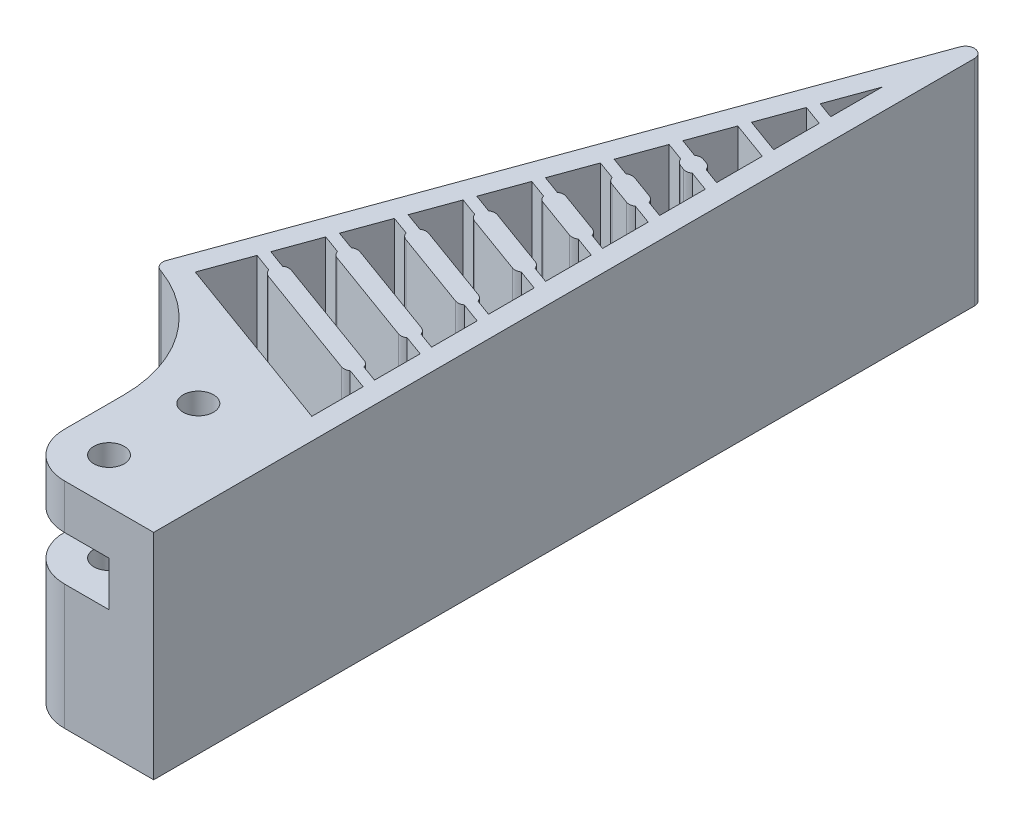
from build123d import *

# Parameters (mm, degrees)
SKETCH_1_R          = 1.7
EXTRUDE_1_DEPTH     = 24
CUT_EXTRUDE_START   = -14
SKETCH_2_R          = 1.7
CUT_EXTRUDE_1_DEPTH = 5
FILLET_1_R          = 1
FILLET_2_R          = 15


with BuildPart() as part:
    # 草图1 → 凸台-拉伸1 (new body)
    with BuildSketch(Plane(origin=(0, 0, 0), x_dir=(1, 0, 0), z_dir=(0, 1, 0))):
        with BuildLine():
            Line((-5, 17.140740034), (-5, 0))
            ThreePointArc((-5, 0), (-3.535533906, -3.535533906), (0, -5))
            Line((0, -5), (10, -5))
            Line((10, -5), (10, 92.570484452))
            Line((10, 92.570484452), (-15.997319233, 21.143436891))
            Line((-15.997319233, 21.143436891), (-5, 17.140740034))
        make_face()
        with Locations(Location((0, 0, 0), (0, 0, 270))):
            Circle(SKETCH_1_R, mode=Mode.SUBTRACT)
        with Locations(Location((0, 10, 0), (0, 0, 270))):
            Circle(SKETCH_1_R, mode=Mode.SUBTRACT)
        with BuildLine():
            Line((7.6, 15.108741736), (-12.9212086, 22.577850837))
            Line((-12.9212086, 22.577850837), (-11.074299826, 27.65219099))
            Line((-11.074299826, 27.65219099), (-9.00697606, 26.899746674))
            ThreePointArc((-9.00697606, 26.899746674), (-8.776165309, 26.502415559), (-8.392030021, 26.250253511))
            Line((-8.392030021, 26.250253511), (4.438901994, 21.58017618))
            ThreePointArc((4.438901994, 21.58017618), (4.895253337, 21.526426111), (5.327464148, 21.682437114))
            Line((5.327464148, 21.682437114), (7.6, 20.855301707))
            Line((7.6, 20.855301707), (7.6, 15.108741736))
        make_face(mode=Mode.SUBTRACT)
        with BuildLine():
            ThreePointArc((5.73788832, 22.810068259), (5.507077569, 23.207399374), (5.122942281, 23.459561422))
            Line((5.122942281, 23.459561422), (-7.707989734, 28.129638753))
            ThreePointArc((-7.707989734, 28.129638753), (-8.164341077, 28.183388821), (-8.596551888, 28.027377819))
            Line((-8.596551888, 28.027377819), (-10.663875654, 28.779822134))
            Line((-10.663875654, 28.779822134), (-9.022178966, 33.290346714))
            Line((-9.022178966, 33.290346714), (-6.9548552, 32.537902399))
            ThreePointArc((-6.9548552, 32.537902399), (-6.724044449, 32.140571284), (-6.339909161, 31.888409236))
            Line((-6.339909161, 31.888409236), (4.438901994, 27.965242815))
            ThreePointArc((4.438901994, 27.965242815), (4.895253337, 27.911492746), (5.327464148, 28.067503748))
            Line((5.327464148, 28.067503748), (7.6, 27.240368342))
            Line((7.6, 27.240368342), (7.6, 22.132315034))
            Line((7.6, 22.132315034), (5.73788832, 22.810068259))
        make_face(mode=Mode.SUBTRACT)
        with BuildLine():
            ThreePointArc((5.73788832, 29.195134893), (5.507077569, 29.592466009), (5.122942281, 29.844628056))
            Line((5.122942281, 29.844628056), (-5.655868874, 33.767794478))
            ThreePointArc((-5.655868874, 33.767794478), (-6.112220217, 33.821544546), (-6.544431028, 33.665533544))
            Line((-6.544431028, 33.665533544), (-8.611754794, 34.417977859))
            Line((-8.611754794, 34.417977859), (-6.970058106, 38.928502439))
            Line((-6.970058106, 38.928502439), (-4.90273434, 38.176058124))
            ThreePointArc((-4.90273434, 38.176058124), (-4.671923589, 37.778727008), (-4.287788301, 37.526564961))
            Line((-4.287788301, 37.526564961), (4.438901994, 34.35030945))
            ThreePointArc((4.438901994, 34.35030945), (4.895253337, 34.296559381), (5.327464148, 34.452570383))
            Line((5.327464148, 34.452570383), (7.6, 33.625434977))
            Line((7.6, 33.625434977), (7.6, 28.517381669))
            Line((7.6, 28.517381669), (5.73788832, 29.195134893))
        make_face(mode=Mode.SUBTRACT)
        with BuildLine():
            ThreePointArc((5.73788832, 35.580201528), (5.507077569, 35.977532644), (5.122942281, 36.229694691))
            Line((5.122942281, 36.229694691), (-3.603748014, 39.405950202))
            ThreePointArc((-3.603748014, 39.405950202), (-4.060099357, 39.459700271), (-4.492310168, 39.303689269))
            Line((-4.492310168, 39.303689269), (-6.559633934, 40.056133584))
            Line((-6.559633934, 40.056133584), (-4.917937246, 44.566658164))
            Line((-4.917937246, 44.566658164), (-2.85061348, 43.814213848))
            ThreePointArc((-2.85061348, 43.814213848), (-2.619802729, 43.416882733), (-2.235667441, 43.164720685))
            Line((-2.235667441, 43.164720685), (4.438901994, 40.735376085))
            ThreePointArc((4.438901994, 40.735376085), (4.895253337, 40.681626016), (5.327464148, 40.837637018))
            Line((5.327464148, 40.837637018), (7.6, 40.010501612))
            Line((7.6, 40.010501612), (7.6, 34.902448304))
            Line((7.6, 34.902448304), (5.73788832, 35.580201528))
        make_face(mode=Mode.SUBTRACT)
        with BuildLine():
            ThreePointArc((5.73788832, 41.965268163), (5.507077569, 42.362599278), (5.122942281, 42.614761326))
            Line((5.122942281, 42.614761326), (-1.551627154, 45.044105927))
            ThreePointArc((-1.551627154, 45.044105927), (-2.007978497, 45.097855995), (-2.440189308, 44.941844993))
            Line((-2.440189308, 44.941844993), (-4.507513074, 45.694289309))
            Line((-4.507513074, 45.694289309), (-2.865816386, 50.204813888))
            Line((-2.865816386, 50.204813888), (-0.79849262, 49.452369573))
            ThreePointArc((-0.79849262, 49.452369573), (-0.567681869, 49.055038458), (-0.183546581, 48.80287641))
            Line((-0.183546581, 48.80287641), (4.438901994, 47.120442719))
            ThreePointArc((4.438901994, 47.120442719), (4.895253337, 47.066692651), (5.327464148, 47.222703653))
            Line((5.327464148, 47.222703653), (7.6, 46.395568247))
            Line((7.6, 46.395568247), (7.6, 41.287514939))
            Line((7.6, 41.287514939), (5.73788832, 41.965268163))
        make_face(mode=Mode.SUBTRACT)
        with BuildLine():
            ThreePointArc((5.73788832, 48.350334798), (5.507077569, 48.747665913), (5.122942281, 48.999827961))
            Line((5.122942281, 48.999827961), (0.500493706, 50.682261652))
            ThreePointArc((0.500493706, 50.682261652), (0.044142363, 50.73601172), (-0.388068448, 50.580000718))
            Line((-0.388068448, 50.580000718), (-2.455392214, 51.332445033))
            Line((-2.455392214, 51.332445033), (-0.813695526, 55.842969613))
            Line((-0.813695526, 55.842969613), (1.25362824, 55.090525298))
            ThreePointArc((1.25362824, 55.090525298), (1.484438991, 54.693194182), (1.868574279, 54.441032135))
            Line((1.868574279, 54.441032135), (4.438901994, 53.505509354))
            ThreePointArc((4.438901994, 53.505509354), (4.895253337, 53.451759286), (5.327464148, 53.607770288))
            Line((5.327464148, 53.607770288), (7.6, 52.780634882))
            Line((7.6, 52.780634882), (7.6, 47.672581574))
            Line((7.6, 47.672581574), (5.73788832, 48.350334798))
        make_face(mode=Mode.SUBTRACT)
        with BuildLine():
            ThreePointArc((5.73788832, 54.735401433), (5.507077569, 55.132732548), (5.122942281, 55.384894596))
            Line((5.122942281, 55.384894596), (2.552614566, 56.320417376))
            ThreePointArc((2.552614566, 56.320417376), (2.096263223, 56.374167445), (1.664052412, 56.218156443))
            Line((1.664052412, 56.218156443), (-0.403271354, 56.970600758))
            Line((-0.403271354, 56.970600758), (1.238425334, 61.481125338))
            Line((1.238425334, 61.481125338), (3.3057491, 60.728681023))
            ThreePointArc((3.3057491, 60.728681023), (3.536559851, 60.331349907), (3.920695139, 60.07918786))
            Line((3.920695139, 60.07918786), (4.438901994, 59.890575989))
            ThreePointArc((4.438901994, 59.890575989), (4.895253337, 59.836825921), (5.327464148, 59.992836923))
            Line((5.327464148, 59.992836923), (7.6, 59.165701516))
            Line((7.6, 59.165701516), (7.6, 54.057648209))
            Line((7.6, 54.057648209), (5.73788832, 54.735401433))
        make_face(mode=Mode.SUBTRACT)
        with BuildLine():
            ThreePointArc((5.73788832, 61.120468068), (5.507077569, 61.517799183), (5.122942281, 61.769961231))
            Line((5.122942281, 61.769961231), (4.604735426, 61.958573101))
            ThreePointArc((4.604735426, 61.958573101), (4.148384083, 62.01232317), (3.716173272, 61.856312167))
            Line((3.716173272, 61.856312167), (1.648849506, 62.608756483))
            Line((1.648849506, 62.608756483), (3.290546194, 67.119281063))
            Line((3.290546194, 67.119281063), (7.6, 65.550768151))
            Line((7.6, 65.550768151), (7.6, 60.442714843))
            Line((7.6, 60.442714843), (5.73788832, 61.120468068))
        make_face(mode=Mode.SUBTRACT)
        Polygon((3.700970366, 68.246912207), (5.342667054, 72.757436787), (7.6, 71.935834786), (7.6, 66.827781478), align=None, mode=Mode.SUBTRACT)
        Polygon((5.753091226, 73.885067932), (7.6, 78.959408084), (7.6, 73.212848113), align=None, mode=Mode.SUBTRACT)
    extrude(amount=EXTRUDE_1_DEPTH)

    # 草图2 → 切除-拉伸1 (cut)
    with BuildSketch(Plane.XZ.offset(CUT_EXTRUDE_START)):
        with BuildLine():
            Line((-5, 5), (-5, -14.940041508))
            Line((-5, -14.940041508), (0.2, -14.940041508))
            ThreePointArc((0.2, -14.940041508), (3.59411255, -13.534154057), (5, -10.140041508))
            Line((5, -10.140041508), (5, 5))
            Line((5, 5), (-5, 5))
        make_face()
        with Locations(Location((0, -10, 0), (0, 0, 270))):
            Circle(SKETCH_2_R, mode=Mode.SUBTRACT)
        with Locations(Location((0, 0, 0), (0, 0, 270))):
            Circle(SKETCH_2_R, mode=Mode.SUBTRACT)
    extrude(amount=-CUT_EXTRUDE_1_DEPTH, mode=Mode.SUBTRACT)

    # 圆角1
    fillet_1_edges = [part.edges().sort_by_distance(p)[0] for p in [
        (-15.997319233, 12, -21.143436891),
        (10, 12, -92.570484452),
    ]]
    fillet(fillet_1_edges, radius=FILLET_1_R)

    # 圆角2
    # the kernel refuses this fillet: 15 mm, written as the material it adds along each edge
    with BuildSketch(Plane(origin=(-5, 0, -17.140740034), x_dir=(-0.9396926207859096, 0, -0.34202014332566527), z_dir=(0, 1, 0))) as fillet_2_piece_1_section:
        with BuildLine():
            CenterArc((FILLET_2_R * 0.70020753821, FILLET_2_R), FILLET_2_R, 200, 70)
            Line((-FILLET_2_R * 0.239485082576, FILLET_2_R * 0.657979856674), (0, 0))
            Line((0, 0), (FILLET_2_R * 0.70020753821, 0))
        make_face()
    fillet_2_piece_1 = extrude(amount=24, mode=Mode.PRIVATE)
    fillet_2_piece_1 = split(fillet_2_piece_1, bisect_by=Plane(origin=(-8.048588234, 14, -17.376417802), z_dir=(0, -1, 0)), keep=Keep.TOP, mode=Mode.PRIVATE)
    fillet_2_piece_1 = split(fillet_2_piece_1, bisect_by=Plane(origin=(-8.048588234, 7, -14.940041508), z_dir=(0, 0, -1)), keep=Keep.TOP, mode=Mode.PRIVATE)
    add(fillet_2_piece_1)
    with BuildSketch(Plane(origin=(-5, 0, -17.140740034), x_dir=(-0.9396926207859096, 0, -0.34202014332566527), z_dir=(0, 1, 0))) as fillet_2_piece_2_section:
        with BuildLine():
            CenterArc((FILLET_2_R * 0.70020753821, FILLET_2_R), FILLET_2_R, 200, 70)
            Line((-FILLET_2_R * 0.239485082576, FILLET_2_R * 0.657979856674), (0, 0))
            Line((0, 0), (FILLET_2_R * 0.70020753821, 0))
        make_face()
    fillet_2_piece_2 = extrude(amount=24, mode=Mode.PRIVATE)
    fillet_2_piece_2 = split(fillet_2_piece_2, bisect_by=Plane(origin=(-5.498513848, 14, -12.327693201), z_dir=(0, -1, 0)), keep=Keep.TOP, mode=Mode.PRIVATE)
    fillet_2_piece_2 = split(fillet_2_piece_2, bisect_by=Plane(origin=(-5.498513848, 7, -14.940041508), z_dir=(0, 0, 1)), keep=Keep.TOP, mode=Mode.PRIVATE)
    add(fillet_2_piece_2)
    with BuildSketch(Plane(origin=(-5, 0, -17.140740034), x_dir=(-0.9396926207859096, 0, -0.34202014332566527), z_dir=(0, 1, 0))) as fillet_2_piece_3_section:
        with BuildLine():
            CenterArc((FILLET_2_R * 0.70020753821, FILLET_2_R), FILLET_2_R, 200, 70)
            Line((-FILLET_2_R * 0.239485082576, FILLET_2_R * 0.657979856674), (0, 0))
            Line((0, 0), (FILLET_2_R * 0.70020753821, 0))
        make_face()
    fillet_2_piece_3 = extrude(amount=24, mode=Mode.PRIVATE)
    fillet_2_piece_3 = split(fillet_2_piece_3, bisect_by=Plane(origin=(-8.048588234, 14, -17.376417802), z_dir=(0, 1, 0)), keep=Keep.TOP, mode=Mode.PRIVATE)
    fillet_2_piece_3 = split(fillet_2_piece_3, bisect_by=Plane(origin=(-8.048588234, 16.5, -14.940041508), z_dir=(0, 0, -1)), keep=Keep.TOP, mode=Mode.PRIVATE)
    fillet_2_piece_3 = split(fillet_2_piece_3, bisect_by=Plane(origin=(-8.048588234, 19, -17.376417802), z_dir=(0, -1, 0)), keep=Keep.TOP, mode=Mode.PRIVATE)
    add(fillet_2_piece_3)
    with BuildSketch(Plane(origin=(-5, 0, -17.140740034), x_dir=(-0.9396926207859096, 0, -0.34202014332566527), z_dir=(0, 1, 0))) as fillet_2_piece_4_section:
        with BuildLine():
            CenterArc((FILLET_2_R * 0.70020753821, FILLET_2_R), FILLET_2_R, 200, 70)
            Line((-FILLET_2_R * 0.239485082576, FILLET_2_R * 0.657979856674), (0, 0))
            Line((0, 0), (FILLET_2_R * 0.70020753821, 0))
        make_face()
    fillet_2_piece_4 = extrude(amount=24, mode=Mode.PRIVATE)
    fillet_2_piece_4 = split(fillet_2_piece_4, bisect_by=Plane(origin=(-8.048588234, 21.5, -14.940041508), z_dir=(0, 0, -1)), keep=Keep.TOP, mode=Mode.PRIVATE)
    fillet_2_piece_4 = split(fillet_2_piece_4, bisect_by=Plane(origin=(-8.048588234, 19, -17.376417802), z_dir=(0, 1, 0)), keep=Keep.TOP, mode=Mode.PRIVATE)
    add(fillet_2_piece_4)
    with BuildSketch(Plane(origin=(-5, 0, -17.140740034), x_dir=(-0.9396926207859096, 0, -0.34202014332566527), z_dir=(0, 1, 0))) as fillet_2_piece_5_section:
        with BuildLine():
            CenterArc((FILLET_2_R * 0.70020753821, FILLET_2_R), FILLET_2_R, 200, 70)
            Line((-FILLET_2_R * 0.239485082576, FILLET_2_R * 0.657979856674), (0, 0))
            Line((0, 0), (FILLET_2_R * 0.70020753821, 0))
        make_face()
    fillet_2_piece_5 = extrude(amount=24, mode=Mode.PRIVATE)
    fillet_2_piece_5 = split(fillet_2_piece_5, bisect_by=Plane(origin=(-5.498513848, 21.5, -14.940041508), z_dir=(0, 0, 1)), keep=Keep.TOP, mode=Mode.PRIVATE)
    fillet_2_piece_5 = split(fillet_2_piece_5, bisect_by=Plane(origin=(-5.498513848, 19, -12.327693201), z_dir=(0, 1, 0)), keep=Keep.TOP, mode=Mode.PRIVATE)
    add(fillet_2_piece_5)


solid = part.part
